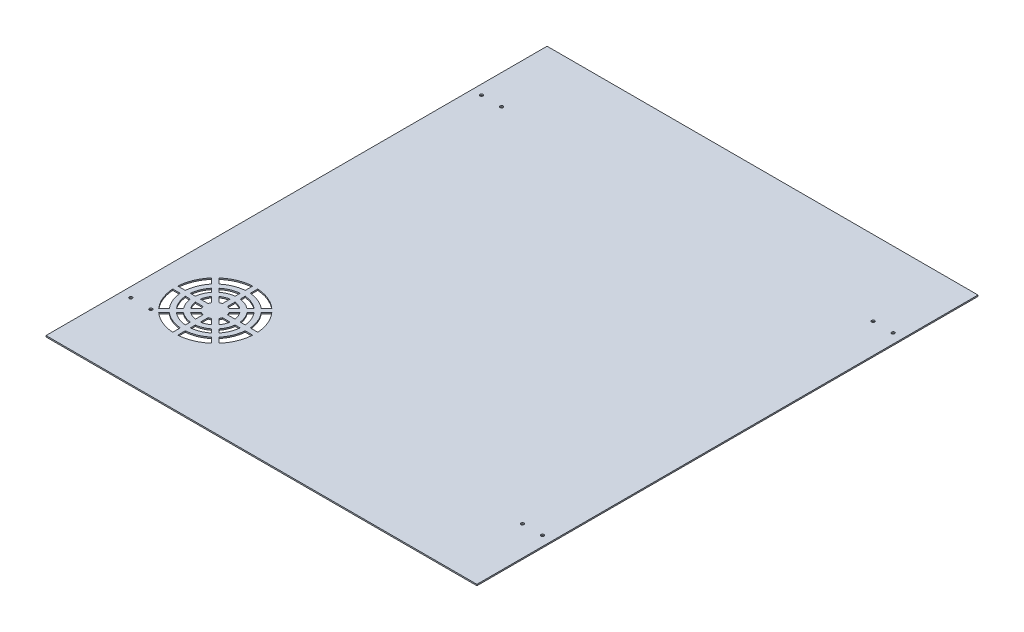
from build123d import *

# Parameters (mm, degrees)
SKETCH1_W          = 430
SKETCH1_H          = 500
BASE_FLANGE1_DEPTH = 1.291
SKETCH8_R          = 1.5
SKETCH8_R_2        = 1.498030926
CUT_EXTRUDE3_DEPTH = 10
VENT1_START        = -1.291
VENT1_DEPTH        = 1.291


# Read off the part's stored shape, not the designer's step: Vent1
# Sheet-metal steps are written as plain solids
with BuildPart() as part:
    # Sketch1 → Base-Flange1 (new body)
    with BuildSketch(Plane(origin=(0, 0, 0), x_dir=(1, 0, 0), z_dir=(0, 1, 0))):
        with Locations((-4865, 5137.258064516)):
            Rectangle(SKETCH1_W, SKETCH1_H)
    extrude(amount=-BASE_FLANGE1_DEPTH)

    # Sketch8 → Cut-Extrude3 (cut)
    with BuildSketch(Plane(origin=(0, -1.291, 0), x_dir=(-1, 0, 0), z_dir=(0, -1, 0))):
        with Locations(Location((5070.34, 5312.228571298, 0), (0, 0, 90))):
            Circle(SKETCH8_R)
        with Locations(Location((5070.34, 4962.228571297, 0), (0, 0, 90))):
            Circle(SKETCH8_R_2)
        with Locations(Location((4659.6, 4962.228571297, 0), (0, 0, 90))):
            Circle(SKETCH8_R)
        with Locations(Location((4659.6, 5312.228571298, 0), (0, 0, 90))):
            Circle(SKETCH8_R)
        with Locations(Location((4679.6, 4962.228571297, 0), (0, 0, 90))):
            Circle(SKETCH8_R)
        with Locations(Location((5050.34, 4962.228571297, 0), (0, 0, 90))):
            Circle(SKETCH8_R)
        with Locations(Location((5050.34, 5312.228571298, 0), (0, 0, 90))):
            Circle(SKETCH8_R)
        with Locations(Location((4679.6, 5312.228571298, 0), (0, 0, 90))):
            Circle(SKETCH8_R)
    extrude(amount=-CUT_EXTRUDE3_DEPTH, mode=Mode.SUBTRACT)

    # Vent1 outline → Vent1 (cut)
    with BuildSketch(Plane(origin=(0, 0, 0), x_dir=(1, 0, 0), z_dir=(0, 1, 0)).offset(VENT1_START)):
        with BuildLine():
            add(Edge.make_bspline(
                [(-5047.085335822, 4966.772094057), (-5047.399655142, 4967.128287702), (-5048.55625834, 4968.487092247), (-5050.400143927, 4970.975107858), (-5052.422713634, 4974.346833591), (-5054.10247076, 4977.901601645), (-5055.428382612, 4981.603121238), (-5056.382364881, 4985.41728908), (-5056.837878002, 4988.480570545), (-5056.980867783, 4990.259231675), (-5057.010488383, 4990.733531126)],
                knots=[0.384953473, 0.384953473, 0.384953473, 0.384953473, 0.390623946, 0.406249995, 0.421873996, 0.437499995, 0.453123946, 0.468749995, 0.484373946, 0.490046514, 0.490046514, 0.490046514, 0.490046514], degree=3))
            Line((-5047.085335822, 4966.772094057), (-5041.768921923, 4972.08848635))
            add(Edge.make_bspline(
                [(-5041.768921923, 4972.08848635), (-5042.610118704, 4973.070398686), (-5044.680444098, 4975.800317576), (-5047.308008787, 4980.716145354), (-5048.926055099, 4986.050129206), (-5049.392458136, 4989.444414369), (-5049.491959064, 4990.733547068)],
                knots=[0.387254773, 0.387254773, 0.387254773, 0.387254773, 0.40625, 0.4375, 0.46875, 0.487745226, 0.487745226, 0.487745226, 0.487745226], degree=3))
            Line((-5049.491959064, 4990.733547068), (-5057.010488383, 4990.733531126))
        make_face()
        with BuildLine():
            add(Edge.make_bspline(
                [(-4987.091404215, 5019.694965108), (-4986.777084895, 5019.338771463), (-4985.620481698, 5017.979966917), (-4983.776596138, 5015.491951302), (-4981.754026302, 5012.120225586), (-4980.074269656, 5008.565457468), (-4978.748356014, 5004.863938113), (-4977.794370217, 5001.049728552), (-4977.338842105, 4997.986448126), (-4977.1958576, 4996.207786013), (-4977.16624089, 4995.733527794)],
                knots=[0.884953473, 0.884953473, 0.884953473, 0.884953473, 0.890623946, 0.906249995, 0.921873996, 0.937499995, 0.953123946, 0.968749995, 0.984374448, 0.990046522, 0.990046522, 0.990046522, 0.990046522], degree=3))
            Line((-4987.091404215, 5019.694965108), (-4992.407818115, 5014.378572813))
            add(Edge.make_bspline(
                [(-4992.407818115, 5014.378572813), (-4991.566621334, 5013.396660478), (-4989.49629594, 5010.666741587), (-4986.868731251, 5005.75091381), (-4985.250684885, 5000.41692978), (-4984.784281852, 4997.022644429), (-4984.684780931, 4995.733511544)],
                knots=[0.887254773, 0.887254773, 0.887254773, 0.887254773, 0.90625, 0.9375, 0.96875, 0.987745228, 0.987745228, 0.987745228, 0.987745228], degree=3))
            Line((-4984.684780931, 4995.733511544), (-4977.16624089, 4995.733527794))
        make_face()
        with BuildLine():
            add(Edge.make_bspline(
                [(-5057.010486439, 4995.733527025), (-5056.980876522, 4996.207651194), (-5056.837897869, 4997.986312918), (-5056.382434463, 5001.049421762), (-5055.428437092, 5004.863764695), (-5054.10260644, 5008.565129296), (-5052.422797273, 5012.120069072), (-5050.400341483, 5015.491656167), (-5048.55636775, 5017.979822476), (-5047.399773795, 5019.338635049), (-5047.085335692, 5019.694963506)],
                knots=[0.509953474, 0.509953474, 0.509953474, 0.509953474, 0.515623946, 0.531249995, 0.546873896, 0.562499995, 0.578123896, 0.593749995, 0.609373896, 0.615046513, 0.615046513, 0.615046513, 0.615046513], degree=3))
            Line((-5057.010486439, 4995.733527025), (-5049.491959091, 4995.733511739))
            add(Edge.make_bspline(
                [(-5049.491959091, 4995.733511739), (-5049.392458168, 4997.022644558), (-5048.926055134, 5000.416929843), (-5047.308008787, 5005.75091381), (-5044.680444149, 5010.666741492), (-5042.610118834, 5013.396660306), (-5041.768922133, 5014.378572569)],
                knots=[0.512254773, 0.512254773, 0.512254773, 0.512254773, 0.53125, 0.5625, 0.59375, 0.612745226, 0.612745226, 0.612745226, 0.612745226], degree=3))
            Line((-5041.768922133, 5014.378572569), (-5047.085335692, 5019.694963506))
        make_face()
        with BuildLine():
            add(Edge.make_bspline(
                [(-5043.549805544, 5023.230495385), (-5043.193611899, 5023.544814704), (-5041.834807354, 5024.701417903), (-5039.346791743, 5026.545303489), (-5035.97506601, 5028.567873197), (-5032.420297955, 5030.247630323), (-5028.718778363, 5031.573542174), (-5024.90461052, 5032.527524443), (-5021.841329056, 5032.983037565), (-5020.062667926, 5033.126027346), (-5019.588368474, 5033.155647946)],
                knots=[0.634953473, 0.634953473, 0.634953473, 0.634953473, 0.640623946, 0.656249995, 0.671873996, 0.687499995, 0.703123946, 0.718749995, 0.734373946, 0.740046514, 0.740046514, 0.740046514, 0.740046514], degree=3))
            Line((-5043.549805544, 5023.230495385), (-5038.233413251, 5017.914081486))
            add(Edge.make_bspline(
                [(-5038.233413251, 5017.914081486), (-5037.251500915, 5018.755278267), (-5034.521582024, 5020.825603661), (-5029.605754247, 5023.45316835), (-5024.271770395, 5025.071214662), (-5020.877485232, 5025.537617699), (-5019.588352533, 5025.637118627)],
                knots=[0.637254773, 0.637254773, 0.637254773, 0.637254773, 0.65625, 0.6875, 0.71875, 0.737745226, 0.737745226, 0.737745226, 0.737745226], degree=3))
            Line((-5019.588352533, 5025.637118627), (-5019.588368474, 5033.155647946))
        make_face()
        with BuildLine():
            add(Edge.make_bspline(
                [(-4990.626934494, 4963.236563779), (-4990.983128141, 4962.922244458), (-4992.341932686, 4961.76564126), (-4994.829948296, 4959.921755673), (-4998.201674028, 4957.899185967), (-5001.756442083, 4956.21942884), (-5005.457961675, 4954.893516989), (-5009.272129518, 4953.93953472), (-5012.335410982, 4953.484021599), (-5014.114072112, 4953.341031818), (-5014.588371564, 4953.311411218)],
                knots=[0.134953473, 0.134953473, 0.134953473, 0.134953473, 0.140623946, 0.156249995, 0.171873996, 0.187499995, 0.203123946, 0.218749995, 0.234373946, 0.240046514, 0.240046514, 0.240046514, 0.240046514], degree=3))
            Line((-4990.626934494, 4963.236563779), (-4995.943326787, 4968.552977678))
            add(Edge.make_bspline(
                [(-4995.943326787, 4968.552977678), (-4996.925239123, 4967.711780897), (-4999.655158014, 4965.641455503), (-5004.570985791, 4963.013890813), (-5009.904969643, 4961.395844501), (-5013.299254806, 4960.929441465), (-5014.588387505, 4960.829940537)],
                knots=[0.137254773, 0.137254773, 0.137254773, 0.137254773, 0.15625, 0.1875, 0.21875, 0.237745226, 0.237745226, 0.237745226, 0.237745226], degree=3))
            Line((-5014.588387505, 4960.829940537), (-5014.588371564, 4953.311411218))
        make_face()
        with BuildLine():
            add(Edge.make_bspline(
                [(-5014.588372576, 5033.155646001), (-5014.114248407, 5033.126036085), (-5012.335586683, 5032.983057432), (-5009.272477838, 5032.527594026), (-5005.458134905, 5031.573596655), (-5001.756770305, 5030.247766003), (-4998.201830529, 5028.567956836), (-4994.830243434, 5026.545501045), (-4992.342077125, 5024.701527313), (-4990.983264552, 5023.544933358), (-4990.626936095, 5023.230495255)],
                knots=[0.759953474, 0.759953474, 0.759953474, 0.759953474, 0.765623946, 0.781249995, 0.796873896, 0.812499995, 0.828123896, 0.843749995, 0.859373896, 0.865046513, 0.865046513, 0.865046513, 0.865046513], degree=3))
            Line((-5014.588372576, 5033.155646001), (-5014.588387862, 5025.637118654))
            add(Edge.make_bspline(
                [(-5014.588387862, 5025.637118654), (-5013.299255042, 5025.537617731), (-5009.904969758, 5025.071214697), (-5004.570985791, 5023.45316835), (-4999.655158119, 5020.825603717), (-4996.925239313, 5018.755278411), (-4995.943327059, 5017.914081719)],
                knots=[0.762254773, 0.762254773, 0.762254773, 0.762254773, 0.78125, 0.8125, 0.84375, 0.862745226, 0.862745226, 0.862745226, 0.862745226], degree=3))
            Line((-4995.943327059, 5017.914081719), (-4990.626936095, 5023.230495255))
        make_face()
        with BuildLine():
            add(Edge.make_bspline(
                [(-4977.166264362, 4990.733531895), (-4977.195878167, 4990.259366499), (-4977.338862094, 4988.480705758), (-4977.794310516, 4985.417595875), (-4978.748304358, 4981.603294656), (-4980.07413322, 4977.901929817), (-4981.753942866, 4974.346990105), (-4983.776398529, 4970.975402991), (-4985.620372288, 4968.487236686), (-4986.776966245, 4967.128424114), (-4987.091404347, 4966.772095659)],
                knots=[0.009953481, 0.009953481, 0.009953481, 0.009953481, 0.015624448, 0.031249995, 0.046873896, 0.062499995, 0.078123896, 0.093749995, 0.109373896, 0.115046513, 0.115046513, 0.115046513, 0.115046513], degree=3))
            Line((-4977.166264362, 4990.733531895), (-4984.684780989, 4990.733546873))
            add(Edge.make_bspline(
                [(-4984.684780989, 4990.733546873), (-4984.78428192, 4989.444414239), (-4985.250684958, 4986.050129143), (-4986.868731251, 4980.716145354), (-4989.496295889, 4975.800317671), (-4991.566621204, 4973.070398857), (-4992.407817905, 4972.088486595)],
                knots=[0.012254775, 0.012254775, 0.012254775, 0.012254775, 0.03125, 0.0625, 0.09375, 0.112745226, 0.112745226, 0.112745226, 0.112745226], degree=3))
            Line((-4992.407817905, 4972.088486595), (-4987.091404347, 4966.772095659))
        make_face()
        with BuildLine():
            add(Edge.make_bspline(
                [(-5019.588367462, 4953.311413162), (-5020.062491631, 4953.341023078), (-5021.841153355, 4953.484001732), (-5024.9042622, 4953.939465138), (-5028.718605133, 4954.893462509), (-5032.419969733, 4956.219293161), (-5035.974909509, 4957.899102328), (-5039.346496605, 4959.921558118), (-5041.834662913, 4961.765531851), (-5043.193475486, 4962.922125805), (-5043.549803943, 4963.236563909)],
                knots=[0.259953474, 0.259953474, 0.259953474, 0.259953474, 0.265623946, 0.281249995, 0.296873896, 0.312499995, 0.328123896, 0.343749995, 0.359373896, 0.365046513, 0.365046513, 0.365046513, 0.365046513], degree=3))
            Line((-5019.588367462, 4953.311413162), (-5019.588352176, 4960.829940509))
            add(Edge.make_bspline(
                [(-5019.588352176, 4960.829940509), (-5020.877484996, 4960.929441432), (-5024.27177028, 4961.395844467), (-5029.605754247, 4963.013890813), (-5034.521581929, 4965.641455452), (-5037.251500744, 4967.711780767), (-5038.233413006, 4968.552977468)],
                knots=[0.262254773, 0.262254773, 0.262254773, 0.262254773, 0.28125, 0.3125, 0.34375, 0.362745226, 0.362745226, 0.362745226, 0.362745226], degree=3))
            Line((-5038.233413006, 4968.552977468), (-5043.549803943, 4963.236563909))
        make_face()
        with BuildLine():
            add(Edge.make_bspline(
                [(-4999.767903277, 4990.733540506), (-4999.8120542, 4990.427528261), (-5000.057892739, 4988.993391003), (-5000.816256836, 4986.493399613), (-5002.047773595, 4984.18939381), (-5002.888028094, 4983.001471075), (-5003.073192402, 4982.753867854)],
                knots=[0.022814392, 0.022814392, 0.022814392, 0.022814392, 0.03125, 0.0625, 0.09375, 0.102185625, 0.102185625, 0.102185625, 0.102185625], degree=3))
            Line((-4999.767903277, 4990.733540506), (-5007.405935002, 4990.733543779))
            add(Edge.make_bspline(
                [(-5007.405935002, 4990.733543779), (-5007.522642527, 4990.281639763), (-5007.819288897, 4989.394151355), (-5008.237077203, 4988.556841579), (-5008.474096401, 4988.154773148)],
                knots=[0.040215222, 0.040215222, 0.040215222, 0.040215222, 0.0625, 0.084784739, 0.084784739, 0.084784739, 0.084784739], degree=3))
            Line((-5008.474096401, 4988.154773148), (-5003.073192402, 4982.753867854))
        make_face()
        with BuildLine():
            Line((-4989.702348922, 4990.733529601), (-4994.727773557, 4990.733547544))
            add(Edge.make_bspline(
                [(-4994.727773557, 4990.733547544), (-4994.798601051, 4990.099924479), (-4995.122023, 4988.012744836), (-4996.167081641, 4984.567648193), (-4997.864164941, 4981.392628656), (-4999.111330197, 4979.688075687), (-4999.509286985, 4979.189953684)],
                knots=[0.017720397, 0.017720397, 0.017720397, 0.017720397, 0.03125, 0.0625, 0.09375, 0.10727961, 0.10727961, 0.10727961, 0.10727961], degree=3))
            Line((-4999.509286985, 4979.189953684), (-4995.955761852, 4975.636455294))
            add(Edge.make_bspline(
                [(-4989.702348922, 4990.733529601), (-4989.790122601, 4989.77214337), (-4990.18632017, 4987.031548441), (-4991.517906446, 4982.641896774), (-4993.680285222, 4978.596370627), (-4995.338024493, 4976.378323381), (-4995.955761852, 4975.636455294)],
                knots=[0.014488699, 0.014488699, 0.014488699, 0.014488699, 0.03125, 0.0625, 0.09375, 0.110511301, 0.110511301, 0.110511301, 0.110511301], degree=3))
        make_face()
        with BuildLine():
            add(Edge.make_bspline(
                [(-5003.073191552, 5003.713190172), (-5002.888027547, 5003.465587315), (-5002.047773371, 5002.277664934), (-5000.816256836, 4999.973659551), (-5000.05789252, 4997.47366744), (-4999.812053947, 4996.039529426), (-4999.767902956, 4995.733516434)],
                knots=[0.897814388, 0.897814388, 0.897814388, 0.897814388, 0.90625, 0.9375, 0.96875, 0.977185628, 0.977185628, 0.977185628, 0.977185628], degree=3))
            Line((-5003.073191552, 5003.713190172), (-5008.474097646, 4998.312288127))
            add(Edge.make_bspline(
                [(-5008.474097646, 4998.312288127), (-5008.237077935, 4997.910219051), (-5007.819289521, 4997.072909314), (-5007.522643043, 4996.185420945), (-5007.405935611, 4995.733517745)],
                knots=[0.915215222, 0.915215222, 0.915215222, 0.915215222, 0.9375, 0.959784739, 0.959784739, 0.959784739, 0.959784739], degree=3))
            Line((-5007.405935611, 4995.733517745), (-4999.767902956, 4995.733516434))
        make_face()
        with BuildLine():
            Line((-4995.955761852, 5010.83060387), (-4999.509286732, 5007.277105162))
            add(Edge.make_bspline(
                [(-4999.509286732, 5007.277105162), (-4999.111330037, 5006.778983258), (-4997.864164876, 5005.074430388), (-4996.167081641, 5001.89941097), (-4995.122022842, 4998.454313809), (-4994.798600886, 4996.367133618), (-4994.727773378, 4995.733510012)],
                knots=[0.892720393, 0.892720393, 0.892720393, 0.892720393, 0.90625, 0.9375, 0.96875, 0.982279614, 0.982279614, 0.982279614, 0.982279614], degree=3))
            Line((-4994.727773378, 4995.733510012), (-4989.702348922, 4995.733529563))
            add(Edge.make_bspline(
                [(-4995.955761852, 5010.83060387), (-4995.338024493, 5010.088735783), (-4993.680285222, 5007.870688537), (-4991.517906446, 5003.82516239), (-4990.18632017, 4999.435510722), (-4989.790122601, 4996.694915794), (-4989.702348922, 4995.733529563)],
                knots=[0.889488699, 0.889488699, 0.889488699, 0.889488699, 0.90625, 0.9375, 0.96875, 0.985511301, 0.985511301, 0.985511301, 0.985511301], degree=3))
        make_face()
        with BuildLine():
            add(Edge.make_bspline(
                [(-5031.103548487, 4982.753868992), (-5031.288712491, 4983.001471849), (-5032.128966668, 4984.18939423), (-5033.360483202, 4986.493399613), (-5034.118847477, 4988.993391591), (-5034.364686045, 4990.427529466), (-5034.408837023, 4990.73354232)],
                knots=[0.397814388, 0.397814388, 0.397814388, 0.397814388, 0.40625, 0.4375, 0.46875, 0.477185625, 0.477185625, 0.477185625, 0.477185625], degree=3))
            Line((-5031.103548487, 4982.753868992), (-5025.702642392, 4988.154771037))
            add(Edge.make_bspline(
                [(-5025.702642392, 4988.154771037), (-5025.939662104, 4988.556840113), (-5026.357450517, 4989.394149849), (-5026.654096995, 4990.281638218), (-5026.770804427, 4990.733541418)],
                knots=[0.415215222, 0.415215222, 0.415215222, 0.415215222, 0.4375, 0.459784739, 0.459784739, 0.459784739, 0.459784739], degree=3))
            Line((-5026.770804427, 4990.733541418), (-5034.408837023, 4990.73354232))
        make_face()
        with BuildLine():
            Line((-5038.220978186, 4975.636455293), (-5034.667453306, 4979.189954002))
            add(Edge.make_bspline(
                [(-5034.667453306, 4979.189954002), (-5035.065410001, 4979.688075906), (-5036.312575162, 4981.392628776), (-5038.009658397, 4984.567648193), (-5039.054717133, 4988.012745148), (-5039.378139086, 4990.099925121), (-5039.448966589, 4990.733548511)],
                knots=[0.392720393, 0.392720393, 0.392720393, 0.392720393, 0.40625, 0.4375, 0.46875, 0.48227961, 0.48227961, 0.48227961, 0.48227961], degree=3))
            Line((-5039.448966589, 4990.733548511), (-5044.474391116, 4990.733529601))
            add(Edge.make_bspline(
                [(-5038.220978186, 4975.636455293), (-5038.838715545, 4976.378323381), (-5040.496454816, 4978.596370627), (-5042.658833592, 4982.641896774), (-5043.990419868, 4987.031548441), (-5044.386617437, 4989.77214337), (-5044.474391116, 4990.733529601)],
                knots=[0.389488699, 0.389488699, 0.389488699, 0.389488699, 0.40625, 0.4375, 0.46875, 0.485511301, 0.485511301, 0.485511301, 0.485511301], degree=3))
        make_face()
        with BuildLine():
            add(Edge.make_bspline(
                [(-5034.40883682, 4995.733518248), (-5034.364685885, 4996.039530631), (-5034.118847339, 4997.473668028), (-5033.360483202, 4999.973659551), (-5032.128966443, 5002.277665353), (-5031.288711945, 5003.465588087), (-5031.103547636, 5003.713191308)],
                knots=[0.522814388, 0.522814388, 0.522814388, 0.522814388, 0.53125, 0.5625, 0.59375, 0.602185625, 0.602185625, 0.602185625, 0.602185625], degree=3))
            Line((-5034.40883682, 4995.733518248), (-5026.770805036, 4995.733515385))
            add(Edge.make_bspline(
                [(-5026.770805036, 4995.733515385), (-5026.654097511, 4996.1854194), (-5026.357451141, 4997.072907809), (-5025.939662835, 4997.910217585), (-5025.702643637, 4998.312286015)],
                knots=[0.540215222, 0.540215222, 0.540215222, 0.540215222, 0.5625, 0.584784739, 0.584784739, 0.584784739, 0.584784739], degree=3))
            Line((-5025.702643637, 4998.312286015), (-5031.103547636, 5003.713191308))
        make_face()
        with BuildLine():
            Line((-5044.474391116, 4995.733529562), (-5039.448966552, 4995.73351098))
            add(Edge.make_bspline(
                [(-5039.448966552, 4995.73351098), (-5039.378139052, 4996.36713426), (-5039.054717101, 4998.454314121), (-5038.009658397, 5001.89941097), (-5036.312575097, 5005.074430508), (-5035.065409841, 5006.778983476), (-5034.667453053, 5007.27710548)],
                knots=[0.517720393, 0.517720393, 0.517720393, 0.517720393, 0.53125, 0.5625, 0.59375, 0.60727961, 0.60727961, 0.60727961, 0.60727961], degree=3))
            Line((-5034.667453053, 5007.27710548), (-5038.220978186, 5010.83060387))
            add(Edge.make_bspline(
                [(-5044.474391116, 4995.733529562), (-5044.386617437, 4996.694915793), (-5043.990419868, 4999.435510722), (-5042.658833592, 5003.82516239), (-5040.496454816, 5007.870688537), (-5038.838715545, 5010.088735783), (-5038.220978186, 5010.83060387)],
                knots=[0.514488699, 0.514488699, 0.514488699, 0.514488699, 0.53125, 0.5625, 0.59375, 0.610511301, 0.610511301, 0.610511301, 0.610511301], degree=3))
        make_face()
        with BuildLine():
            add(Edge.make_bspline(
                [(-5027.56803061, 5007.248708049), (-5027.320427752, 5007.433872054), (-5026.132505371, 5008.27412623), (-5023.828499988, 5009.505642765), (-5021.32850801, 5010.26400704), (-5019.894370135, 5010.509845607), (-5019.588357281, 5010.553996586)],
                knots=[0.647814388, 0.647814388, 0.647814388, 0.647814388, 0.65625, 0.6875, 0.71875, 0.727185625, 0.727185625, 0.727185625, 0.727185625], degree=3))
            Line((-5027.56803061, 5007.248708049), (-5022.167128564, 5001.847801955))
            add(Edge.make_bspline(
                [(-5022.167128564, 5001.847801955), (-5021.765059488, 5002.084821666), (-5020.927749756, 5002.502610078), (-5020.040261391, 5002.799256555), (-5019.588358195, 5002.915963986)],
                knots=[0.665215222, 0.665215222, 0.665215222, 0.665215222, 0.6875, 0.709784739, 0.709784739, 0.709784739, 0.709784739], degree=3))
            Line((-5019.588358195, 5002.915963986), (-5019.588357281, 5010.553996586))
        make_face()
        with BuildLine():
            Line((-5034.685444307, 5014.366137749), (-5031.131945599, 5010.812612869))
            add(Edge.make_bspline(
                [(-5031.131945599, 5010.812612869), (-5030.633823695, 5011.210569564), (-5028.929270825, 5012.457734724), (-5025.754251408, 5014.15481796), (-5022.309154453, 5015.199876696), (-5020.22197448, 5015.523298649), (-5019.58835109, 5015.594126151)],
                knots=[0.642720393, 0.642720393, 0.642720393, 0.642720393, 0.65625, 0.6875, 0.71875, 0.73227961, 0.73227961, 0.73227961, 0.73227961], degree=3))
            Line((-5019.58835109, 5015.594126151), (-5019.58837, 5020.619550679))
            add(Edge.make_bspline(
                [(-5034.685444307, 5014.366137749), (-5033.94357622, 5014.983875108), (-5031.725528974, 5016.641614379), (-5027.680002827, 5018.803993155), (-5023.290351159, 5020.135579431), (-5020.549756231, 5020.531777), (-5019.58837, 5020.619550679)],
                knots=[0.639488699, 0.639488699, 0.639488699, 0.639488699, 0.65625, 0.6875, 0.71875, 0.735511301, 0.735511301, 0.735511301, 0.735511301], degree=3))
        make_face()
        with BuildLine():
            add(Edge.make_bspline(
                [(-5014.588381354, 5010.553996383), (-5014.282368971, 5010.509845448), (-5012.848231573, 5010.264006902), (-5010.34824005, 5009.505642765), (-5008.044234248, 5008.274126006), (-5006.856311513, 5007.433871507), (-5006.608708293, 5007.248707199)],
                knots=[0.772814388, 0.772814388, 0.772814388, 0.772814388, 0.78125, 0.8125, 0.84375, 0.852185625, 0.852185625, 0.852185625, 0.852185625], degree=3))
            Line((-5014.588381354, 5010.553996383), (-5014.588384216, 5002.915964599))
            add(Edge.make_bspline(
                [(-5014.588384216, 5002.915964599), (-5014.136480201, 5002.799257074), (-5013.248991792, 5002.502610703), (-5012.411682016, 5002.084822398), (-5012.009613586, 5001.8478032)],
                knots=[0.790215222, 0.790215222, 0.790215222, 0.790215222, 0.8125, 0.834784739, 0.834784739, 0.834784739, 0.834784739], degree=3))
            Line((-5012.009613586, 5001.8478032), (-5006.608708293, 5007.248707199))
        make_face()
        with BuildLine():
            Line((-5014.588370038, 5020.619550679), (-5014.588388621, 5015.594126115))
            add(Edge.make_bspline(
                [(-5014.588388621, 5015.594126115), (-5013.954765341, 5015.523298615), (-5011.86758548, 5015.199876664), (-5008.42248863, 5014.15481796), (-5005.247469093, 5012.45773466), (-5003.542916124, 5011.210569404), (-5003.044794121, 5010.812612616)],
                knots=[0.767720393, 0.767720393, 0.767720393, 0.767720393, 0.78125, 0.8125, 0.84375, 0.85727961, 0.85727961, 0.85727961, 0.85727961], degree=3))
            Line((-5003.044794121, 5010.812612616), (-4999.491295731, 5014.366137749))
            add(Edge.make_bspline(
                [(-5014.588370038, 5020.619550679), (-5013.626983807, 5020.531777), (-5010.886388879, 5020.135579431), (-5006.496737211, 5018.803993155), (-5002.451211064, 5016.641614379), (-5000.233163818, 5014.983875108), (-4999.491295731, 5014.366137749)],
                knots=[0.764488699, 0.764488699, 0.764488699, 0.764488699, 0.78125, 0.8125, 0.84375, 0.860511301, 0.860511301, 0.860511301, 0.860511301], degree=3))
        make_face()
        with BuildLine():
            add(Edge.make_bspline(
                [(-5019.588358686, 4975.91306278), (-5019.894371068, 4975.957213716), (-5021.328508465, 4976.203052261), (-5023.828499988, 4976.961416399), (-5026.13250579, 4978.192933158), (-5027.320428525, 4979.033187657), (-5027.568031746, 4979.218351965)],
                knots=[0.272814388, 0.272814388, 0.272814388, 0.272814388, 0.28125, 0.3125, 0.34375, 0.352185625, 0.352185625, 0.352185625, 0.352185625], degree=3))
            Line((-5019.588358686, 4975.91306278), (-5019.588355822, 4983.551094565))
            add(Edge.make_bspline(
                [(-5019.588355822, 4983.551094565), (-5020.040259837, 4983.66780209), (-5020.927748246, 4983.96444846), (-5021.765058022, 4984.382236766), (-5022.167126452, 4984.619255964)],
                knots=[0.290215222, 0.290215222, 0.290215222, 0.290215222, 0.3125, 0.334784739, 0.334784739, 0.334784739, 0.334784739], degree=3))
            Line((-5022.167126452, 4984.619255964), (-5027.568031746, 4979.218351965))
        make_face()
        with BuildLine():
            Line((-5019.58837, 4965.847508485), (-5019.588351417, 4970.872933049))
            add(Edge.make_bspline(
                [(-5019.588351417, 4970.872933049), (-5020.221974697, 4970.943760548), (-5022.309154558, 4971.2671825), (-5025.754251408, 4972.312241204), (-5028.929270945, 4974.009324503), (-5030.633823914, 4975.25648976), (-5031.131945917, 4975.654446548)],
                knots=[0.267720393, 0.267720393, 0.267720393, 0.267720393, 0.28125, 0.3125, 0.34375, 0.35727961, 0.35727961, 0.35727961, 0.35727961], degree=3))
            Line((-5031.131945917, 4975.654446548), (-5034.685444307, 4972.100921415))
            add(Edge.make_bspline(
                [(-5019.58837, 4965.847508485), (-5020.549756231, 4965.935282164), (-5023.290351159, 4966.331479733), (-5027.680002827, 4967.663066009), (-5031.725528974, 4969.825444785), (-5033.94357622, 4971.483184055), (-5034.685444307, 4972.100921415)],
                knots=[0.264488699, 0.264488699, 0.264488699, 0.264488699, 0.28125, 0.3125, 0.34375, 0.360511301, 0.360511301, 0.360511301, 0.360511301], degree=3))
        make_face()
        with BuildLine():
            Line((-4999.491295731, 4972.100921415), (-5003.044794439, 4975.654446294))
            add(Edge.make_bspline(
                [(-5003.044794439, 4975.654446294), (-5003.542916343, 4975.2564896), (-5005.247469213, 4974.009324439), (-5008.42248863, 4972.312241204), (-5011.867585585, 4971.267182468), (-5013.954765559, 4970.943760515), (-5014.588388949, 4970.872933012)],
                knots=[0.142720393, 0.142720393, 0.142720393, 0.142720393, 0.15625, 0.1875, 0.21875, 0.23227961, 0.23227961, 0.23227961, 0.23227961], degree=3))
            Line((-5014.588388949, 4970.872933012), (-5014.588370038, 4965.847508485))
            add(Edge.make_bspline(
                [(-4999.491295731, 4972.100921415), (-5000.233163818, 4971.483184055), (-5002.451211064, 4969.825444785), (-5006.496737211, 4967.663066009), (-5010.886388879, 4966.331479733), (-5013.626983807, 4965.935282164), (-5014.588370038, 4965.847508485)],
                knots=[0.139488699, 0.139488699, 0.139488699, 0.139488699, 0.15625, 0.1875, 0.21875, 0.235511301, 0.235511301, 0.235511301, 0.235511301], degree=3))
        make_face()
        with BuildLine():
            add(Edge.make_bspline(
                [(-5006.608709429, 4979.218351114), (-5006.856312286, 4979.033187109), (-5008.044234667, 4978.192932933), (-5010.34824005, 4976.961416399), (-5012.848232028, 4976.203052123), (-5014.282369904, 4975.957213556), (-5014.588382759, 4975.913062577)],
                knots=[0.147814388, 0.147814388, 0.147814388, 0.147814388, 0.15625, 0.1875, 0.21875, 0.227185625, 0.227185625, 0.227185625, 0.227185625], degree=3))
            Line((-5006.608709429, 4979.218351114), (-5012.009611474, 4984.619257209))
            add(Edge.make_bspline(
                [(-5012.009611474, 4984.619257209), (-5012.41168055, 4984.382237497), (-5013.248990287, 4983.964449083), (-5014.136478657, 4983.667802606), (-5014.588381857, 4983.551095174)],
                knots=[0.165215222, 0.165215222, 0.165215222, 0.165215222, 0.1875, 0.209784739, 0.209784739, 0.209784739, 0.209784739], degree=3))
            Line((-5014.588381857, 4983.551095174), (-5014.588382759, 4975.913062577))
        make_face()
    extrude(amount=VENT1_DEPTH, mode=Mode.SUBTRACT)


solid = part.part
